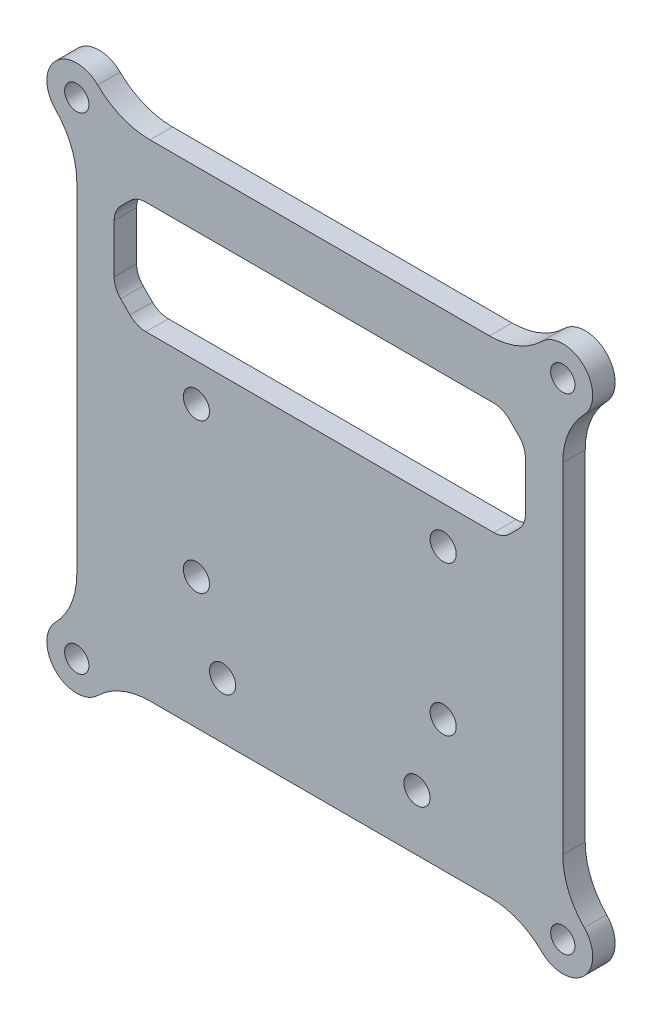
from build123d import *

# Parameters (mm, degrees)
SKETCH_1_R          = 1.625
EXTRUDE_1_DEPTH     = 3
FILLET_1_R          = 10
SKETCH_2_R          = 1.75
CUT_EXTRUDE_1_DEPTH = 10
SKETCH_4_R          = 1.75
CUT_EXTRUDE_2_DEPTH = 10
SKETCH_5_R          = 1.75
CUT_EXTRUDE_3_DEPTH = 10
CUT_EXTRUDE_4_DEPTH = 10
FILLET_2_R          = 3


with BuildPart() as part:
    # Эскиз1 → Бобышка-Вытянуть1 (new body)
    with BuildSketch(Plane.XY):
        with BuildLine():
            Line((-32.5, 28.5), (-32.5, -28.5))
            ThreePointArc((-32.5, -28.5), (-35.328427125, -35.328427125), (-28.5, -32.5))
            Line((-28.5, -32.5), (28.5, -32.5))
            ThreePointArc((28.5, -32.5), (35.328427125, -35.328427125), (32.5, -28.5))
            Line((32.5, -28.5), (32.5, 28.5))
            ThreePointArc((32.5, 28.5), (35.328427125, 35.328427125), (28.5, 32.5))
            Line((28.5, 32.5), (-28.5, 32.5))
            ThreePointArc((-28.5, 32.5), (-35.328427125, 35.328427125), (-32.5, 28.5))
        make_face()
        with Locations((-32.5, -32.5)):
            Circle(SKETCH_1_R, mode=Mode.SUBTRACT)
        with Locations((-32.5, 32.5)):
            Circle(SKETCH_1_R, mode=Mode.SUBTRACT)
        with Locations((32.5, 32.5)):
            Circle(SKETCH_1_R, mode=Mode.SUBTRACT)
        with Locations((32.5, -32.5)):
            Circle(SKETCH_1_R, mode=Mode.SUBTRACT)
    extrude(amount=EXTRUDE_1_DEPTH)

    # Скругление1
    fillet_1_edges = [part.edges().sort_by_distance(p)[0] for p in [
        (-28.5, -32.5, 1.5),
        (-32.5, -28.5, 1.5),
        (-28.5, 32.5, 1.5),
        (-32.5, 28.5, 1.5),
        (28.5, 32.5, 1.5),
        (32.5, 28.5, 1.5),
        (32.5, -28.5, 1.5),
        (28.5, -32.5, 1.5),
    ]]
    fillet(fillet_1_edges, radius=FILLET_1_R)

    # Эскиз2 → Вырез-Вытянуть1 (cut)
    with BuildSketch(Plane.XY.offset(3)):
        with Locations((-13, -25)):
            Circle(SKETCH_2_R)
        with Locations((13, -25)):
            Circle(SKETCH_2_R)
    extrude(amount=-CUT_EXTRUDE_1_DEPTH, mode=Mode.SUBTRACT)

    # Эскиз4 → Вырез-Вытянуть2 (cut)
    with BuildSketch(Plane.XY.offset(3)):
        with Locations((-16.5, -15)):
            Circle(SKETCH_4_R)
        with Locations((16.5, -15)):
            Circle(SKETCH_4_R)
    extrude(amount=-CUT_EXTRUDE_2_DEPTH, mode=Mode.SUBTRACT)

    # Эскиз5 → Вырез-Вытянуть3 (cut)
    with BuildSketch(Plane.XY.offset(3)):
        with Locations((-16.5, 5)):
            Circle(SKETCH_5_R)
        with Locations((16.5, 5)):
            Circle(SKETCH_5_R)
    extrude(amount=-CUT_EXTRUDE_3_DEPTH, mode=Mode.SUBTRACT)

    # Эскиз7 → Вырез-Вытянуть4 (cut)
    with BuildSketch(Plane.XY.offset(3)):
        Polygon((-24.5, 25), (24.5, 25), (27.5, 22), (27.5, 13), (24.5, 10), (-24.5, 10), (-27.5, 13), (-27.5, 22), align=None)
    extrude(amount=-CUT_EXTRUDE_4_DEPTH, mode=Mode.SUBTRACT)

    # Скругление2
    fillet_2_edges = [part.edges().sort_by_distance(p)[0] for p in [
        (27.5, 22, 1.5),
        (24.5, 25, 1.5),
        (27.5, 13, 1.5),
        (24.5, 10, 1.5),
        (-24.5, 10, 1.5),
        (-27.5, 13, 1.5),
        (-24.5, 25, 1.5),
        (-27.5, 22, 1.5),
    ]]
    fillet(fillet_2_edges, radius=FILLET_2_R)


solid = part.part
